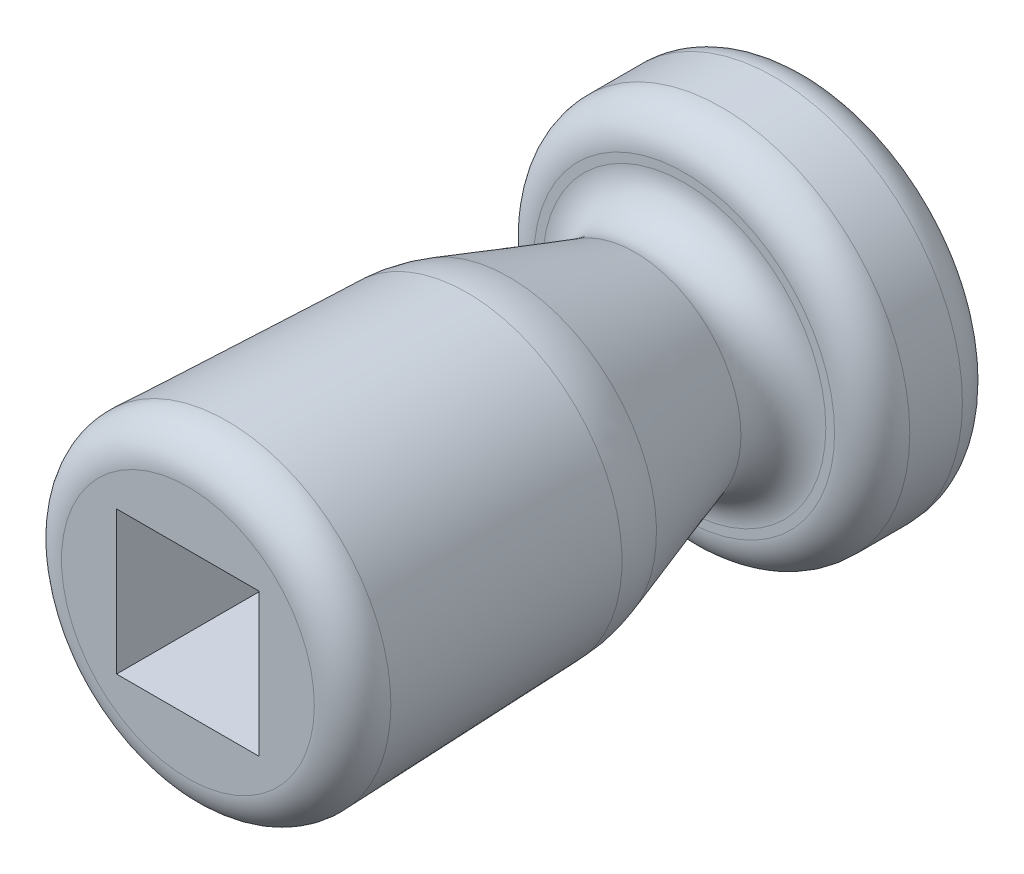
from build123d import *

# Parameters (mm, degrees)
SKETCH_1_R          = 2.5
EXTRUDE_1_DEPTH     = 1.7
FILLET_7_R          = 0.5
SKETCH_7_R          = 2.050609665
SKETCH_8_R          = 2.2
SKETCH_10_W         = 1.896668422
SKETCH_10_H         = 1.902308834
CUT_EXTRUDE_1_DEPTH = 4
FILLET_13_R         = 0.5
FILLET_17_R         = 2
FILLET_18_R         = 0.5
FILLET_19_R         = 0.5


with BuildPart() as part:
    # 草图1 → 凸台-拉伸1 (new body)
    with BuildSketch(Plane.XY):
        Circle(SKETCH_1_R)
    extrude(amount=EXTRUDE_1_DEPTH)

    # 圆角7
    fillet_7_edges = [part.edges().sort_by_distance(p)[0] for p in [
        (-2.5, 0, 0),
    ]]
    fillet(fillet_7_edges, radius=FILLET_7_R)

    # 放样1: read off the stored shape, not the designer's step
    # 放样1: loft between two sections, ruled curve by curve
    loft_1_from = [
        Edge.make_bspline([(0.665743614, 0.998391427, 1.7), (-1.33103924, 2.329878654, 1.7), (-2.662526467, 0.333095801, 1.7), (-0.665743614, -0.998391427, 1.7), (1.33103924, -2.329878654, 1.7), (2.662526467, -0.333095801, 1.7), (0.665743614, 0.998391427, 1.7)], [0, 0, 0, 0, 0.5, 0.5, 0.5, 1, 1, 1, 1], 3, [1, 0.333333333, 0.333333333, 1, 0.333333333, 0.333333333, 1]),
    ]
    loft_1_to = [
        Edge.make_bspline([(1.45, 1.45, 4.3), (-1.45, 4.35, 4.3), (-4.35, 1.45, 4.3), (-1.45, -1.45, 4.3), (1.45, -4.35, 4.3), (4.35, -1.45, 4.3), (1.45, 1.45, 4.3)], [0, 0, 0, 0, 0.5, 0.5, 0.5, 1, 1, 1, 1], 3, [1, 0.333333333, 0.333333333, 1, 0.333333333, 0.333333333, 1]),
    ]
    loft_1 = Solid(Shell([*[Face.make_surface_from_curves(loft_1_from[k], loft_1_to[k]) for k in range(1)], Face(Wire(loft_1_from)), Face(Wire(loft_1_to))]))
    add(loft_1)

    # 草图7 → 放样3 section 0
    with BuildSketch(Plane.XY.offset(4.3)):
        Circle(SKETCH_7_R)
    # 草图8 → 放样3 section 1
    with BuildSketch(Plane.XY.offset(8.3)):
        Circle(SKETCH_8_R)
    loft()

    # 草图10 → 切除-拉伸1 (cut)
    with BuildSketch(Plane.XY.offset(8.3)):
        Rectangle(SKETCH_10_W, SKETCH_10_H)
    extrude(amount=-CUT_EXTRUDE_1_DEPTH, mode=Mode.SUBTRACT)

    # 圆角13
    fillet_13_edges = [part.edges().sort_by_distance(p)[0] for p in [
        (-2.5, 0, 1.7),
    ]]
    fillet(fillet_13_edges, radius=FILLET_13_R)

    # 圆角17
    fillet_17_edges = [part.edges().sort_by_distance(p)[0] for p in [
        (-1.894516299, -0.784734346, 4.3),
    ]]
    fillet(fillet_17_edges, radius=FILLET_17_R)

    # 圆角18
    fillet_18_edges = [part.edges().sort_by_distance(p)[0] for p in [
        (-0.665743614, -0.998391427, 1.7),
    ]]
    fillet(fillet_18_edges, radius=FILLET_18_R)

    # 圆角19
    fillet_19_edges = [part.edges().sort_by_distance(p)[0] for p in [
        (-2.2, 0, 8.3),
    ]]
    fillet(fillet_19_edges, radius=FILLET_19_R)


solid = part.part
